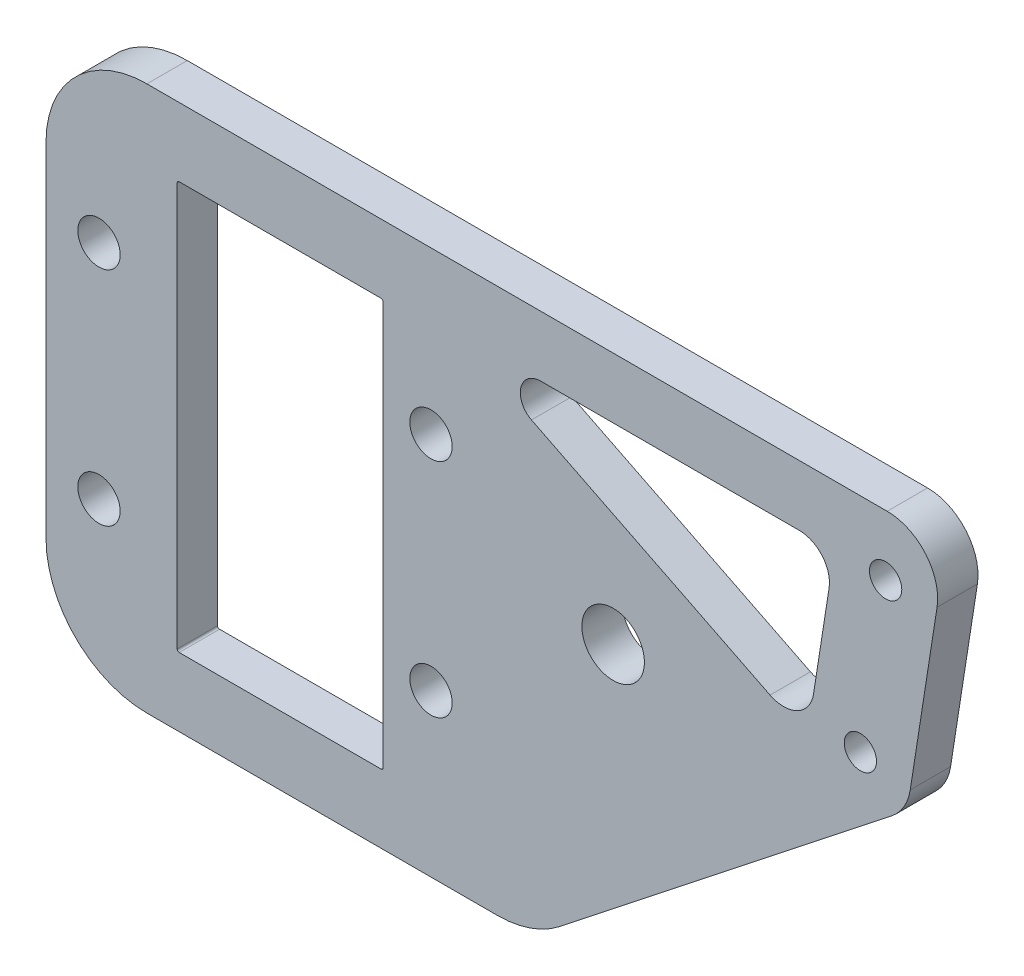
from build123d import *

# Parameters (mm, degrees)
SKETCH_1_R          = 3.1
SKETCH_1_R_2        = 1.6
SKETCH_1_W          = 20.4
SKETCH_1_H          = 40.4
EXTRUDE_1_DEPTH     = 4
FILLET_1_R          = 0.2
SKETCH_2_R          = 2.1
CUT_EXTRUDE_1_DEPTH = 4
CUT_EXTRUDE_2_DEPTH = 10


with BuildPart() as part:
    # 草图1 → 凸台-拉伸1 (new body)
    with BuildSketch(Plane.XY):
        with BuildLine():
            Line((-13.2, 27), (60.15625, 27))
            ThreePointArc((60.15625, 27), (63.954895943, 25.251198086), (65.096310169, 21.228115599))
            Line((65.096310169, 21.228115599), (62.440060169, 4.228115599))
            ThreePointArc((62.440060169, 4.228115599), (61.816569536, 2.476663431), (60.596300169, 1.074070141))
            Line((60.596300169, 1.074070141), (27.72371786, -24.851859719))
            ThreePointArc((27.72371786, -24.851859719), (24.808418455, -26.447713935), (21.531117522, -27))
            Line((21.531117522, -27), (-13.2, -27))
            ThreePointArc((-13.2, -27), (-20.271067812, -24.071067812), (-23.2, -17))
            Line((-23.2, -17), (-23.2, 17))
            ThreePointArc((-23.2, 17), (-20.271067812, 24.071067812), (-13.2, 27))
        make_face()
        with Locations((33, 2)):
            Circle(SKETCH_1_R, mode=Mode.SUBTRACT)
        with Locations((60, 21)):
            Circle(SKETCH_1_R_2, mode=Mode.SUBTRACT)
        with Locations((57.5, 5)):
            Circle(SKETCH_1_R_2, mode=Mode.SUBTRACT)
        Rectangle(SKETCH_1_W, SKETCH_1_H, mode=Mode.SUBTRACT)
    extrude(amount=EXTRUDE_1_DEPTH)

    # 圆角1
    fillet_1_edges = [part.edges().sort_by_distance(p)[0] for p in [
        (10.2, -20.2, 2),
        (-10.2, -20.2, 2),
        (-10.2, 20.2, 2),
        (10.2, 20.2, 2),
    ]]
    fillet(fillet_1_edges, radius=FILLET_1_R)

    # 草图2 → 切除-拉伸1 (cut)
    with BuildSketch(Plane.XY.offset(4)):
        with Locations((14.95, 11)):
            Circle(SKETCH_2_R)
        with Locations((14.95, -11)):
            Circle(SKETCH_2_R)
        with Locations((-17.95, -11)):
            Circle(SKETCH_2_R)
        with Locations((-17.95, 11)):
            Circle(SKETCH_2_R)
    extrude(amount=-CUT_EXTRUDE_1_DEPTH, mode=Mode.SUBTRACT)

    # 草图3 → 切除-拉伸2 (cut)
    with BuildSketch(Plane.XY.offset(4)):
        with BuildLine():
            Line((25.798016292, 21), (51.43418263, 21))
            ThreePointArc((51.43418263, 21), (53.713370196, 19.950718852), (54.398218731, 17.536869359))
            Line((54.398218731, 17.536869359), (52.852232934, 7.642560256))
            ThreePointArc((52.852232934, 7.642560256), (51.264559821, 5.440053089), (48.549531682, 5.420923567))
            Line((48.549531682, 5.420923567), (24.905572858, 17.210155114))
            ThreePointArc((24.905572858, 17.210155114), (23.851263897, 19.458426781), (25.798016292, 21))
        make_face()
    extrude(amount=-CUT_EXTRUDE_2_DEPTH, mode=Mode.SUBTRACT)


solid = part.part
